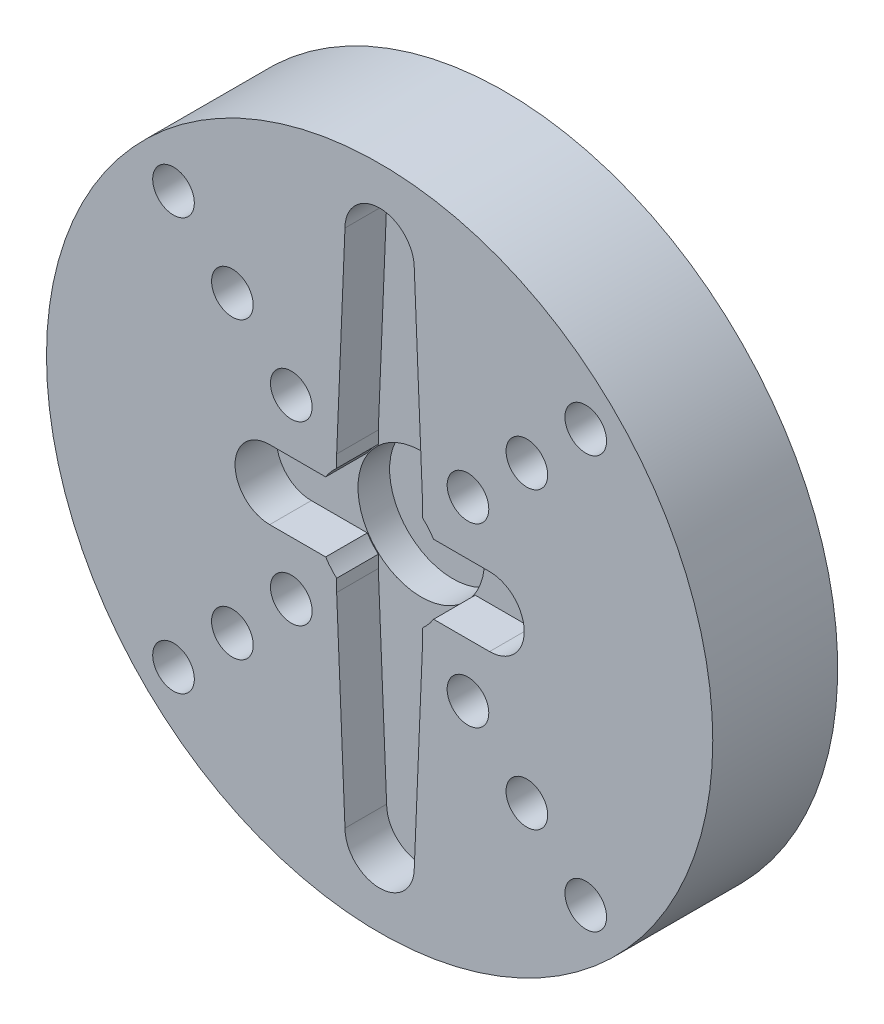
from build123d import *

# Parameters (mm, degrees)
SKETCH1_R               = 20
BOSS_EXTRUDE1_DEPTH     = 4
SKETCH2_R               = 1.25
CUT_EXTRUDE1_DEPTH      = 29.565713714
CAVITY1_START           = 2.8
CAVITY1_OUTLINE_R       = 0.675
CAVITY1_OUTLINE_R_2     = 0.6
CAVITY1_OUTLINE_R_3     = 2.5
CAVITY1_DEPTH           = 1.2
CAVITY1_START_2         = 3.4
CAVITY1_2_OUTLINE_R     = 2.5
CAVITY1_2_OUTLINE_R_2   = 1.25
CAVITY1_2_DEPTH         = 0.6
CUT_EXTRUDE2_START      = -2
CUT_EXTRUDE2_DEPTH      = 2
CUT_EXTRUDE3_START      = -1.2
CUT_EXTRUDE3_DEPTH      = 1.2
CUT_EXTRUDE4_DEPTH      = 1.2
SKETCH6_R               = 1.25
CUT_EXTRUDE5_DEPTH      = 29.565713714
CIRPATTERN1_COUNT       = 4
CUT_EXTRUDE6_DEPTH      = 29.422526278
CUT_EXTRUDE6_DEPTH_BACK = 2.4
SKETCH7_R               = 3.8
SKETCH8_R               = 20
SKETCH8_R_2             = 2.5
SKETCH8_R_3             = 1.25
BOSS_EXTRUDE2_DEPTH     = 3.5
CUT_EXTRUDE7_DEPTH      = 2.5
SKETCH10_R              = 2.5
SKETCH10_R_2            = 1.25
BOSS_EXTRUDE4_DEPTH     = 0.8
SKETCH11_R              = 2.5
SKETCH11_R_2            = 1.25
BOSS_EXTRUDE5_DEPTH     = 1.2
SKETCH12_R              = 3.8
CUT_EXTRUDE8_DEPTH      = 0.8


# Read off the part's stored shape, not the designer's step: Cavity1
with BuildPart() as part:
    # Sketch1 → Boss-Extrude1 (new body)
    with BuildSketch(Plane.XY):
        Circle(SKETCH1_R)
    extrude(amount=BOSS_EXTRUDE1_DEPTH)

    # Sketch2 → Cut-Extrude1 (cut, through all)
    with BuildSketch(Plane.XY.offset(4)):
        Circle(SKETCH2_R)
    extrude(amount=-CUT_EXTRUDE1_DEPTH, mode=Mode.SUBTRACT)

    # Cavity1 outline → Cavity1 (cut)
    with BuildSketch(Plane.XY.offset(CAVITY1_START)):
        with BuildLine():
            ThreePointArc((2.993325909, 2), (2.762479071, 2.308399745), (2.5, 2.590366769))
            Line((2.5, 2.590366769), (2.5, 3.6))
            Line((2.5, 3.6), (2, 15.6))
            ThreePointArc((2, 15.6), (0, 17.6), (-2, 15.6))
            Line((-2, 15.6), (-2.5, 3.6))
            Line((-2.5, 3.6), (-2.5, 2.590366769))
            ThreePointArc((-2.5, 2.590366769), (-2.762479071, 2.308399745), (-2.993325909, 2))
            Line((-2.993325909, 2), (-6.6, 2))
            ThreePointArc((-6.6, 2), (-8.6, 0), (-6.6, -2))
            Line((-6.6, -2), (-2.993325909, -2))
            ThreePointArc((-2.993325909, -2), (-2.762479071, -2.308399745), (-2.5, -2.590366769))
            Line((-2.5, -2.590366769), (-2.5, -3.6))
            Line((-2.5, -3.6), (-2, -15.6))
            ThreePointArc((-2, -15.6), (0, -17.6), (2, -15.6))
            Line((2, -15.6), (2.5, -3.6))
            Line((2.5, -3.6), (2.5, -2.590366769))
            ThreePointArc((2.5, -2.590366769), (2.762479071, -2.308399745), (2.993325909, -2))
            Line((2.993325909, -2), (6.6, -2))
            ThreePointArc((6.6, -2), (8.6, 0), (6.6, 2))
            Line((6.6, 2), (2.993325909, 2))
        make_face()
        with Locations((0, -15.6)):
            Circle(CAVITY1_OUTLINE_R, mode=Mode.SUBTRACT)
        with Locations((0, -13.4)):
            Circle(CAVITY1_OUTLINE_R, mode=Mode.SUBTRACT)
        with Locations((0, -11.2)):
            Circle(CAVITY1_OUTLINE_R, mode=Mode.SUBTRACT)
        with Locations((0, -9)):
            Circle(CAVITY1_OUTLINE_R, mode=Mode.SUBTRACT)
        with Locations((0, -6.8)):
            Circle(CAVITY1_OUTLINE_R, mode=Mode.SUBTRACT)
        with Locations((0, -4.6)):
            Circle(CAVITY1_OUTLINE_R, mode=Mode.SUBTRACT)
        with Locations((-6.6, 0)):
            Circle(CAVITY1_OUTLINE_R_2, mode=Mode.SUBTRACT)
        with Locations((-4.6, 0)):
            Circle(CAVITY1_OUTLINE_R_2, mode=Mode.SUBTRACT)
        Circle(CAVITY1_OUTLINE_R_3, mode=Mode.SUBTRACT)
        with Locations((0, 4.6)):
            Circle(CAVITY1_OUTLINE_R, mode=Mode.SUBTRACT)
        with Locations((0, 6.8)):
            Circle(CAVITY1_OUTLINE_R, mode=Mode.SUBTRACT)
        with Locations((4.6, 0)):
            Circle(CAVITY1_OUTLINE_R_2, mode=Mode.SUBTRACT)
        with Locations((6.6, 0)):
            Circle(CAVITY1_OUTLINE_R_2, mode=Mode.SUBTRACT)
        with Locations((0, 9)):
            Circle(CAVITY1_OUTLINE_R, mode=Mode.SUBTRACT)
        with Locations((0, 11.2)):
            Circle(CAVITY1_OUTLINE_R, mode=Mode.SUBTRACT)
        with Locations((0, 13.4)):
            Circle(CAVITY1_OUTLINE_R, mode=Mode.SUBTRACT)
        with Locations((0, 15.6)):
            Circle(CAVITY1_OUTLINE_R, mode=Mode.SUBTRACT)
    extrude(amount=CAVITY1_DEPTH, mode=Mode.SUBTRACT)

    # Cavity1 2 outline → Cavity1 2 (cut)
    with BuildSketch(Plane.XY.offset(CAVITY1_START_2)):
        Circle(CAVITY1_2_OUTLINE_R)
        Circle(CAVITY1_2_OUTLINE_R_2, mode=Mode.SUBTRACT)
    extrude(amount=CAVITY1_2_DEPTH, mode=Mode.SUBTRACT)

    # Sketch3 → Cut-Extrude2 (cut)
    with BuildSketch(Plane.XY.offset(3.4).offset(CUT_EXTRUDE2_START)):
        with BuildLine():
            ThreePointArc((-2.5, 0), (0, -2.5), (2.5, 0))
            ThreePointArc((2.5, 0), (0, 2.5), (-2.5, 0))
        make_face()
    extrude(amount=CUT_EXTRUDE2_DEPTH, mode=Mode.SUBTRACT)

    # Sketch4 → Cut-Extrude3 (cut)
    with BuildSketch(Plane.XY.offset(4).offset(CUT_EXTRUDE3_START)):
        with BuildLine():
            Line((-6.6, -2), (-2.993325909, -2))
            ThreePointArc((-2.993325909, -2), (-2.762479071, -2.308399745), (-2.5, -2.590366769))
            Line((-2.5, -2.590366769), (-2.5, -3.6))
            Line((-2.5, -3.6), (-2, -15.6))
            ThreePointArc((-2, -15.6), (0, -17.6), (2, -15.6))
            Line((2, -15.6), (2.5, -3.6))
            Line((2.5, -3.6), (2.5, -2.590366769))
            ThreePointArc((2.5, -2.590366769), (2.762479071, -2.308399745), (2.993325909, -2))
            Line((2.993325909, -2), (6.6, -2))
            ThreePointArc((6.6, -2), (8.6, 0), (6.6, 2))
            Line((6.6, 2), (2.993325909, 2))
            ThreePointArc((2.993325909, 2), (2.762479071, 2.308399745), (2.5, 2.590366769))
            Line((2.5, 2.590366769), (2.5, 3.6))
            Line((2.5, 3.6), (2, 15.6))
            ThreePointArc((2, 15.6), (0, 17.6), (-2, 15.6))
            Line((-2, 15.6), (-2.5, 3.6))
            Line((-2.5, 3.6), (-2.5, 2.590366769))
            ThreePointArc((-2.5, 2.590366769), (-2.762479071, 2.308399745), (-2.993325909, 2))
            Line((-2.993325909, 2), (-6.6, 2))
            ThreePointArc((-6.6, 2), (-8.6, 0), (-6.6, -2))
        make_face()
    extrude(amount=CUT_EXTRUDE3_DEPTH, mode=Mode.SUBTRACT)

    # Sketch5 → Cut-Extrude4 (cut)
    with BuildSketch(Plane.XY.offset(4)):
        with BuildLine():
            Line((-6.6, -2.03), (-3.00931886, -2.03))
            ThreePointArc((-3.00931886, -2.03), (-2.784441978, -2.328901645), (-2.53, -2.603075105))
            Line((-2.53, -2.603075105), (-2.53, -3.600624729))
            Line((-2.53, -3.600624729), (-2.029999903, -15.600627053))
            ThreePointArc((-2.029999903, -15.600627053), (0, -17.63), (2.029999903, -15.600627053))
            Line((2.029999903, -15.600627053), (2.53, -3.600624729))
            Line((2.53, -3.600624729), (2.53, -2.603075105))
            ThreePointArc((2.53, -2.603075105), (2.784441978, -2.328901645), (3.00931886, -2.03))
            Line((3.00931886, -2.03), (6.6, -2.03))
            ThreePointArc((6.6, -2.03), (8.63, 0), (6.6, 2.03))
            Line((6.6, 2.03), (3.00931886, 2.03))
            ThreePointArc((3.00931886, 2.03), (2.784441978, 2.328901645), (2.53, 2.603075105))
            Line((2.53, 2.603075105), (2.53, 3.600624729))
            Line((2.53, 3.600624729), (2.029999903, 15.600627053))
            ThreePointArc((2.029999903, 15.600627053), (0, 17.63), (-2.029999903, 15.600627053))
            Line((-2.029999903, 15.600627053), (-2.53, 3.600624729))
            Line((-2.53, 3.600624729), (-2.53, 2.603075105))
            ThreePointArc((-2.53, 2.603075105), (-2.784441978, 2.328901645), (-3.00931886, 2.03))
            Line((-3.00931886, 2.03), (-6.6, 2.03))
            ThreePointArc((-6.6, 2.03), (-8.63, 0), (-6.6, -2.03))
        make_face()
    extrude(amount=-CUT_EXTRUDE4_DEPTH, mode=Mode.SUBTRACT)

    # Sketch6 → Cut-Extrude5 (cut, through all)
    with BuildSketch(Plane.XY.offset(4)):
        with Locations((5.303300859, 5.303300859)):
            Circle(SKETCH6_R)
        with Locations((8.838834765, 8.838834765)):
            Circle(SKETCH6_R)
        with Locations((12.374368671, 12.374368671)):
            Circle(SKETCH6_R)
    cut_extrude5 = extrude(amount=-CUT_EXTRUDE5_DEPTH, mode=Mode.SUBTRACT)

    # CirPattern1: Cut-Extrude5 ×4 about axis
    cirpattern1_axis = Axis((0, 0, 0), (0, 0, 1))
    for i in range(1, CIRPATTERN1_COUNT):
        add(cut_extrude5.rotate(cirpattern1_axis, i * 360 / CIRPATTERN1_COUNT), mode=Mode.SUBTRACT)

    # Sketch7 → Cut-Extrude6 (cut, two sides: drawn at the far end of the back side and taken through both)
    with BuildSketch(Plane.XY.offset(2.8).offset(-CUT_EXTRUDE6_DEPTH_BACK)):
        with Locations(Location((0, 0, 0), (0, 0, 147.709612918))):
            Circle(SKETCH7_R)
    extrude(amount=CUT_EXTRUDE6_DEPTH + CUT_EXTRUDE6_DEPTH_BACK, mode=Mode.SUBTRACT)

    # Sketch8 → Boss-Extrude2 (add)
    with BuildSketch(Plane(origin=(0, 0, 0), x_dir=(-1, 0, 0), z_dir=(0, 0, -1))):
        Circle(SKETCH8_R)
        Circle(SKETCH8_R_2, mode=Mode.SUBTRACT)
        with Locations(Location((12.374368671, 12.374368671, 0), (0, 0, 90))):
            Circle(SKETCH8_R_3, mode=Mode.SUBTRACT)
        with Locations(Location((-12.374368671, 12.374368671, 0), (0, 0, 180))):
            Circle(SKETCH8_R_3, mode=Mode.SUBTRACT)
        with Locations(Location((-8.838834765, 8.838834765, 0), (0, 0, 180))):
            Circle(SKETCH8_R_3, mode=Mode.SUBTRACT)
        with Locations(Location((-5.303300859, 5.303300859, 0), (0, 0, 180))):
            Circle(SKETCH8_R_3, mode=Mode.SUBTRACT)
        with Locations((12.374368671, -12.374368671)):
            Circle(SKETCH8_R_3, mode=Mode.SUBTRACT)
        with Locations((8.838834765, -8.838834765)):
            Circle(SKETCH8_R_3, mode=Mode.SUBTRACT)
        with Locations((5.303300859, -5.303300859)):
            Circle(SKETCH8_R_3, mode=Mode.SUBTRACT)
        with Locations(Location((-12.374368671, -12.374368671, 0), (0, 0, 270))):
            Circle(SKETCH8_R_3, mode=Mode.SUBTRACT)
        with Locations(Location((-8.838834765, -8.838834765, 0), (0, 0, 270))):
            Circle(SKETCH8_R_3, mode=Mode.SUBTRACT)
        with Locations(Location((-5.303300859, -5.303300859, 0), (0, 0, 270))):
            Circle(SKETCH8_R_3, mode=Mode.SUBTRACT)
        with Locations(Location((5.303300859, 5.303300859, 0), (0, 0, 90))):
            Circle(SKETCH8_R_3, mode=Mode.SUBTRACT)
        with Locations(Location((8.838834765, 8.838834765, 0), (0, 0, 90))):
            Circle(SKETCH8_R_3, mode=Mode.SUBTRACT)
    extrude(amount=BOSS_EXTRUDE2_DEPTH)

    # Sketch9 → Cut-Extrude7 (cut)
    with BuildSketch(Plane.XY.offset(4)):
        with BuildLine():
            Line((2.58, 3.601665944), (2.07999932, 15.601682271))
            ThreePointArc((2.07999932, 15.601682271), (0, 17.68), (-2.07999932, 15.601682271))
            Line((-2.07999932, 15.601682271), (-2.58, 3.601665944))
            Line((-2.58, 3.601665944), (-2.58, 2.857638886))
            ThreePointArc((-2.58, 2.857638886), (-2.935746402, 2.490761543), (-3.23976851, 2.08))
            Line((-3.23976851, 2.08), (-6.6, 2.08))
            ThreePointArc((-6.6, 2.08), (-8.68, 0), (-6.6, -2.08))
            Line((-6.6, -2.08), (-3.23976851, -2.08))
            ThreePointArc((-3.23976851, -2.08), (-2.935746402, -2.490761543), (-2.58, -2.857638886))
            Line((-2.58, -2.857638886), (-2.58, -3.601665944))
            Line((-2.58, -3.601665944), (-2.07999932, -15.601682271))
            ThreePointArc((-2.07999932, -15.601682271), (0, -17.68), (2.07999932, -15.601682271))
            Line((2.07999932, -15.601682271), (2.58, -3.601665944))
            Line((2.58, -3.601665944), (2.58, -2.857638886))
            ThreePointArc((2.58, -2.857638886), (2.935746402, -2.490761543), (3.23976851, -2.08))
            Line((3.23976851, -2.08), (6.6, -2.08))
            ThreePointArc((6.6, -2.08), (8.68, 0), (6.6, 2.08))
            Line((6.6, 2.08), (3.23976851, 2.08))
            ThreePointArc((3.23976851, 2.08), (2.935746402, 2.490761543), (2.58, 2.857638886))
            Line((2.58, 2.857638886), (2.58, 3.601665944))
        make_face()
    extrude(amount=-CUT_EXTRUDE7_DEPTH, mode=Mode.SUBTRACT)

    # Sketch10 → Boss-Extrude4 (add)
    with BuildSketch(Plane(origin=(0, 0, 0), x_dir=(-1, 0, 0), z_dir=(0, 0, -1))):
        Circle(SKETCH10_R)
        with Locations(Location((0, 0, 0), (0, 0, 180))):
            Circle(SKETCH10_R_2, mode=Mode.SUBTRACT)
    extrude(amount=BOSS_EXTRUDE4_DEPTH)

    # Sketch11 → Boss-Extrude5 (add)
    with BuildSketch(Plane(origin=(0, 0, -0.8), x_dir=(-1, 0, 0), z_dir=(0, 0, -1))):
        Circle(SKETCH11_R)
        with Locations(Location((0, 0, 0), (0, 0, 180))):
            Circle(SKETCH11_R_2, mode=Mode.SUBTRACT)
    extrude(amount=BOSS_EXTRUDE5_DEPTH)

    # Sketch12 → Cut-Extrude8 (cut)
    with BuildSketch(Plane.XY.offset(0.4)):
        Circle(SKETCH12_R)
    extrude(amount=-CUT_EXTRUDE8_DEPTH, mode=Mode.SUBTRACT)


solid = part.part
